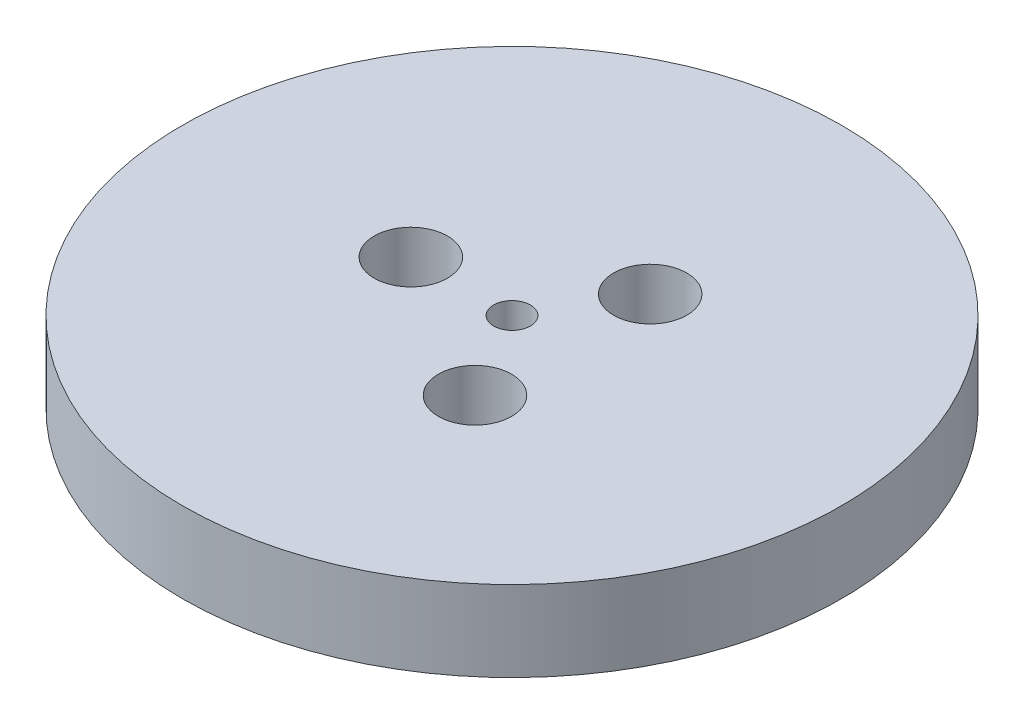
from build123d import *

# Parameters (mm, degrees)
SKETCH1_R           = 90
BOSS_EXTRUDE1_DEPTH = 22
SKETCH2_R           = 5
CUT_EXTRUDE1_DEPTH  = 130.16655914
SKETCH3_R           = 10
CUT_EXTRUDE2_DEPTH  = 19.833752617
CIRPATTERN1_COUNT   = 3


with BuildPart() as part:
    # Sketch1 → Boss-Extrude1 (new body)
    with BuildSketch(Plane(origin=(0, 0, 0), x_dir=(1, 0, 0), z_dir=(0, 1, 0))):
        Circle(SKETCH1_R)
    extrude(amount=BOSS_EXTRUDE1_DEPTH)

    # Sketch2 → Cut-Extrude1 (cut, through all)
    with BuildSketch(Plane(origin=(0, 0, 0), x_dir=(1, 0, 0), z_dir=(0, 1, 0))):
        Circle(SKETCH2_R)
    extrude(amount=CUT_EXTRUDE1_DEPTH, mode=Mode.SUBTRACT)

    # Sketch3 → Cut-Extrude2 (cut)
    with BuildSketch(Plane(origin=(0, 22, 0), x_dir=(1, 0, 0), z_dir=(0, 1, 0))):
        with Locations((-27.624015736, 0)):
            Circle(SKETCH3_R)
    cut_extrude2 = extrude(amount=-CUT_EXTRUDE2_DEPTH, mode=Mode.SUBTRACT)

    # CirPattern1: Cut-Extrude2 ×3 about axis
    cirpattern1_axis = Axis((0, 0, 0), (0, 1, 0))
    for i in range(1, CIRPATTERN1_COUNT):
        add(cut_extrude2.rotate(cirpattern1_axis, i * 360 / CIRPATTERN1_COUNT), mode=Mode.SUBTRACT)


solid = part.part
